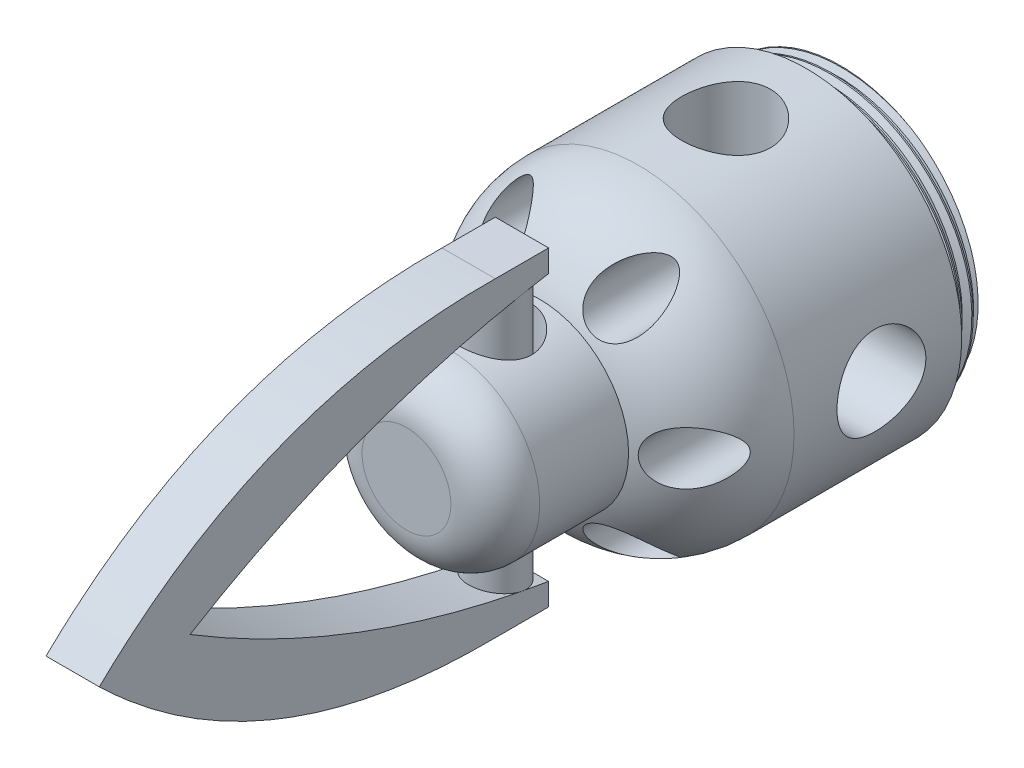
from build123d import *

# Parameters (mm, degrees)
ESQUISSE1_R                  = 15.85
BOSS_EXTRU_1_DEPTH           = 5.6
FILETAGE1_PITCH              = 1.27
ESQUISSE23_R                 = 12.75
ENL_V_MAT_EXTRU_1_DEPTH      = 10
ESQUISSE24_R                 = 17.5
BOSS_EXTRU_3_DEPTH           = 30
ESQUISSE25_R                 = 10
BOSS_EXTRU_4_DEPTH           = 15
CONG_1_R                     = 5
CONG_2_R                     = 12
ESQUISSE29_R                 = 9.933270256
ENL_V_MAT_EXTRU_3_DEPTH      = 10.485
ESQUISSE31_W                 = 56.714390114
ESQUISSE31_H                 = 39.134996148
ENL_V_MAT_EXTRU_4_DEPTH      = 1.75
ENL_V_MAT_EXTRU_5_DEPTH      = 57.32814578
ENL_V_MAT_EXTRU_5_DEPTH_BACK = 57.32814578
ESQUISSE32_R                 = 4.093553295
BOSS_EXTRU_5_DEPTH           = 17.5
BOSS_EXTRU_5_DEPTH_BACK      = 17.5
ESQUISSE34_R                 = 3
BOSS_EXTRU_6_DEPTH           = 3
BOSS_EXTRU_6_DEPTH_BACK      = 3
ESQUISSE37_R                 = 3
ENL_V_MAT_EXTRU_6_DEPTH      = 14
ESQUISSE38_R                 = 5
ENL_V_MAT_EXTRU_7_DEPTH      = 92.580018094
R_P_TITION_CIRCULAIRE1_COUNT = 4


with BuildPart() as part:
    # Esquisse1 → Boss.-Extru.1 (new body)
    with BuildSketch(Plane.XY):
        Circle(ESQUISSE1_R)
    extrude(amount=BOSS_EXTRU_1_DEPTH)

    # Filetage1: the profile of Profil de filetage2 profile screwed along a right-hand helix of 5.19685 turns, 8 arcs to a turn; built about Z, then put on its axis
    filetage1_z = Axis((0, 0, 0), (0, 0, 1))
    filetage1_corners = [(15.8503, 0, -0.000173205), (15.8503, 0, 1.111423202), (15.162592339, 0, 0.714374998), (15.162592339, 0, 0.396874998)]
    with BuildLine(mode=Mode.PRIVATE) as filetage1_profile:
        Line(filetage1_corners[0], filetage1_corners[1])
        Line(filetage1_corners[1], filetage1_corners[2])
        Line(filetage1_corners[2], filetage1_corners[3])
        Line(filetage1_corners[3], filetage1_corners[0])
    filetage1_cap = Face(filetage1_profile.wire())
    filetage1_turn_angles = [0, 22.5, 45, 67.5, 90, 112.5, 135, 157.5, 180, 202.5, 225, 247.5, 270, 292.5, 315, 337.5, 360]
    filetage1_turn_weights = [1, 0.9238795325112867, 1, 0.9238795325112867, 1, 0.9238795325112867, 1, 0.9238795325112867, 1, 0.9238795325112867, 1, 0.9238795325112867, 1, 0.9238795325112867, 1, 0.9238795325112867, 1]
    filetage1_turn_rails = [Edge.make_bspline([Vector(p[0], p[1], 0).rotate(filetage1_z, filetage1_turn_angles[k]) / filetage1_turn_weights[k] + Vector(0, 0, p[2] + FILETAGE1_PITCH * filetage1_turn_angles[k] / 360) for k in range(17)], [0, 0, 0, 1, 1, 2, 2, 3, 3, 4, 4, 5, 5, 6, 6, 7, 7, 8, 8, 8], 2, filetage1_turn_weights) for p in filetage1_corners]
    filetage1_turn_sides = [Face.make_surface_from_curves(filetage1_turn_rails[p[0]], filetage1_turn_rails[p[1]]) for p in [(0, 1), (1, 2), (2, 3), (3, 0)]]
    filetage1_last_angles = [1800, 1822.5, 1845, 1857.933070866, 1870.866141732]
    filetage1_last_weights = [1, 0.9238795325112867, 1, 0.9746321728627877, 1]
    filetage1_last_rails = [Edge.make_bspline([Vector(p[0], p[1], 0).rotate(filetage1_z, filetage1_last_angles[k]) / filetage1_last_weights[k] + Vector(0, 0, p[2] + FILETAGE1_PITCH * filetage1_last_angles[k] / 360) for k in range(5)], [0, 0, 0, 1, 1, 2, 2, 2], 2, filetage1_last_weights) for p in filetage1_corners]
    filetage1_last_sides = [Face.make_surface_from_curves(filetage1_last_rails[p[0]], filetage1_last_rails[p[1]]) for p in [(0, 1), (1, 2), (2, 3), (3, 0)]]
    filetage1 = Plane(origin=(0, 0, -1), x_dir=(1, 0, 0), z_dir=(0, 0, 1)) * Solid(Shell([*[p.moved(Location((0, 0, FILETAGE1_PITCH * i))) for i in range(5) for p in filetage1_turn_sides], *filetage1_last_sides, filetage1_cap, filetage1_cap.rotate(filetage1_z, 1870.866141732).moved(Location((0, 0, FILETAGE1_PITCH * 1870.866141732 / 360)))]))
    add(filetage1, mode=Mode.SUBTRACT)

    # Esquisse23 → Enlèv. mat.-Extru.1 (cut)
    with BuildSketch(Plane(origin=(0, 0, 0), x_dir=(-1, 0, 0), z_dir=(0, 0, -1))):
        Circle(ESQUISSE23_R)
    extrude(amount=-ENL_V_MAT_EXTRU_1_DEPTH, mode=Mode.SUBTRACT)

    # Esquisse31 → Enlèv. mat.-Extru.4 (cut)
    with BuildSketch(Plane(origin=(0, 0, 0), x_dir=(-1, 0, 0), z_dir=(0, 0, -1))):
        Rectangle(ESQUISSE31_W, ESQUISSE31_H)
    extrude(amount=-ENL_V_MAT_EXTRU_4_DEPTH, mode=Mode.SUBTRACT)


with BuildPart() as body_2:
    # Esquisse24 → Boss.-Extru.3 (new body)
    with BuildSketch(Plane.XY.offset(5.6)):
        Circle(ESQUISSE24_R)
    extrude(amount=BOSS_EXTRU_3_DEPTH)

    # Esquisse25 → Boss.-Extru.4 (add)
    with BuildSketch(Plane.XY.offset(35.6)):
        Circle(ESQUISSE25_R)
    extrude(amount=BOSS_EXTRU_4_DEPTH)

    # Congé1
    cong_1_edges = [body_2.edges().sort_by_distance(p)[0] for p in [
        (-10, 0, 50.6),
    ]]
    fillet(cong_1_edges, radius=CONG_1_R)

    # Congé2
    # the kernel refuses this fillet: 12 mm, written as the material it takes off along each edge
    with BuildSketch(Plane(origin=(0, 0, 35.6), x_dir=(1, 0, 0), z_dir=(0, -1, 0))) as cong_2_piece_1:
        with BuildLine():
            CenterArc((5.5, -11.124297731), CONG_2_R, 0, 67.975687163)
            Line((17.5, -11.124297731), (17.74, -11.124297731))
            Line((17.74, -11.124297731), (17.74, 0))
            Line((17.74, 0), (17.5, 0.24))
            ThreePointArc((17.5, 0.24), (13.75, 0.24), (10.09, 0.222485955))
            Line((10.09, 0.222485955), (10, 0))
        make_face()
    revolve(axis=Axis((0, 0, 35.6), (0, 0, 1)), mode=Mode.SUBTRACT)

    # Esquisse29 → Enlèv. mat.-Extru.3 (cut)
    with BuildSketch(Plane(origin=(0, 0, 5.6), x_dir=(-1, 0, 0), z_dir=(0, 0, -1))):
        Circle(ESQUISSE29_R)
    extrude(amount=-ENL_V_MAT_EXTRU_3_DEPTH, mode=Mode.SUBTRACT)

    # Esquisse32 → Enlèv. mat.-Extru.5 (cut, two sides: drawn at the far end of the back side and taken through both)
    with BuildSketch(Plane(origin=(0, 0, 0), x_dir=(1, 0, 0), z_dir=(0, 1, 0)).offset(-ENL_V_MAT_EXTRU_5_DEPTH_BACK)):
        with Locations(Location((0, -40.6, 0), (0, 0, 270))):
            Circle(ESQUISSE32_R)
    extrude(amount=ENL_V_MAT_EXTRU_5_DEPTH + ENL_V_MAT_EXTRU_5_DEPTH_BACK, mode=Mode.SUBTRACT)

    # Esquisse37 → Enlèv. mat.-Extru.6 (cut)
    with BuildSketch(Plane.XY.offset(24.5)):
        with Locations(Location((-13.75, 0, 0), (0, 0, 181.886771676))):
            Circle(ESQUISSE37_R)
        with Locations(Location((-6.875, 11.907849302, 0), (0, 0, 135.904541419))):
            Circle(ESQUISSE37_R)
        with Locations(Location((6.875, 11.907849302, 0), (0, 0, 96.700311808))):
            Circle(ESQUISSE37_R)
        with Locations(Location((13.75, 0, 0), (0, 0, 179.999999538))):
            Circle(ESQUISSE37_R)
        with Locations(Location((6.875, -11.907849302, 0), (0, 0, 268.445880416))):
            Circle(ESQUISSE37_R)
        with Locations(Location((-6.875, -11.907849302, 0), (0, 0, 224.095458581))):
            Circle(ESQUISSE37_R)
    extrude(amount=ENL_V_MAT_EXTRU_6_DEPTH, mode=Mode.SUBTRACT)

    # Esquisse38 → Enlèv. mat.-Extru.7 (cut, symmetric)
    with BuildSketch(Plane(origin=(0, 0, 0), x_dir=(1, 0, 0), z_dir=(0, 1, 0))):
        with Locations(Location((0, -14.639056439, 0), (0, 0, 270))):
            Circle(ESQUISSE38_R)
    enl_v_mat_extru_7 = extrude(amount=ENL_V_MAT_EXTRU_7_DEPTH, both=True, mode=Mode.SUBTRACT)

    # Répétition circulaire1: Enlèv. mat.-Extru.7 ×4 about axis
    r_p_tition_circulaire1_axis = Axis((0, 0, 35.6), (0, 0, -1))
    for i in range(1, R_P_TITION_CIRCULAIRE1_COUNT):
        add(enl_v_mat_extru_7.rotate(r_p_tition_circulaire1_axis, i * 360 / R_P_TITION_CIRCULAIRE1_COUNT), mode=Mode.SUBTRACT)


with BuildPart() as body_3:
    # Esquisse34 → Boss.-Extru.5 (new, two sides: drawn at the far end of the back side and taken through both)
    with BuildSketch(Plane(origin=(0, 0, 0), x_dir=(1, 0, 0), z_dir=(0, 1, 0)).offset(-BOSS_EXTRU_5_DEPTH_BACK)):
        with Locations(Location((0, -40.6, 0), (0, 0, 270))):
            Circle(ESQUISSE34_R)
    extrude(amount=BOSS_EXTRU_5_DEPTH + BOSS_EXTRU_5_DEPTH_BACK)

    # Esquisse35 → Boss.-Extru.6 (add, two sides: drawn at the far end of the back side and taken through both)
    with BuildSketch(Plane(origin=(0, 0, 0), x_dir=(0, 0, -1), z_dir=(1, 0, 0)).offset(-BOSS_EXTRU_6_DEPTH_BACK)):
        with BuildLine():
            Line((-43.6, 17.5), (-37.6, 17.5))
            Line((-37.6, 17.5), (-37.6, 15))
            add(Edge.make_bspline(
                [(-37.6, 15), (-59.169462705, 11.424875084), (-77.963320391, 0)],
                knots=[0, 0, 0, 1, 1, 1], degree=2))
            add(Edge.make_bspline(
                [(-37.6, -15), (-59.169462705, -11.424875084), (-77.963320391, 0)],
                knots=[0, 0, 0, 1, 1, 1], degree=2))
            Line((-37.6, -15), (-37.6, -17.5))
            Line((-37.6, -17.5), (-43.6, -17.5))
            add(Edge.make_bspline(
                [(-43.6, -17.5), (-69.762737144, -17.814346604), (-88.171474332, 0)],
                knots=[0, 0, 0, 1, 1, 1], degree=2))
            add(Edge.make_bspline(
                [(-43.6, 17.5), (-69.762737144, 17.814346604), (-88.171474332, 0)],
                knots=[0, 0, 0, 1, 1, 1], degree=2))
        make_face()
    extrude(amount=BOSS_EXTRU_6_DEPTH + BOSS_EXTRU_6_DEPTH_BACK)


solid = Compound([part.part, body_2.part, body_3.part])
